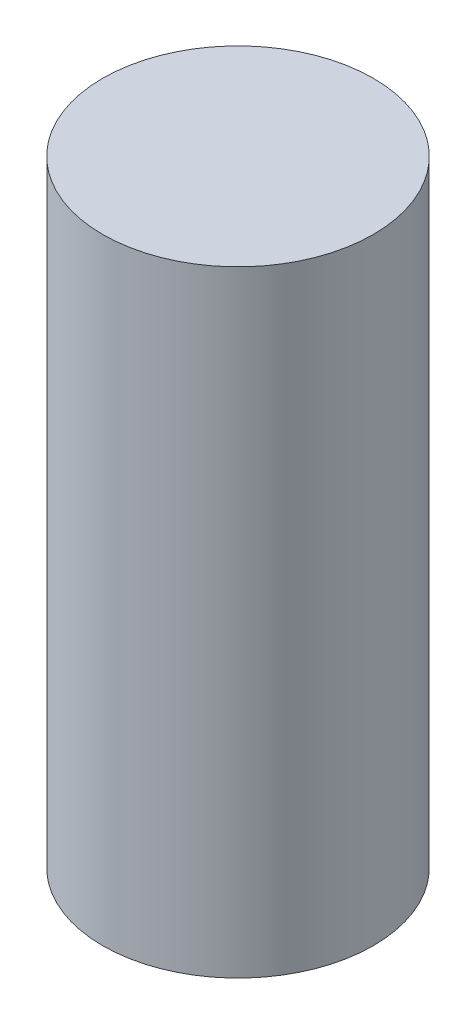
from build123d import *

# Parameters (mm, degrees)
SKETCH1_R           = 22.404077652
BOSS_EXTRUDE1_DEPTH = 102


with BuildPart() as part:
    # Sketch1 → Boss-Extrude1 (new body)
    with BuildSketch(Plane(origin=(0, 0, 0), x_dir=(1, 0, 0), z_dir=(0, 1, 0))):
        with Locations((2.600880996, 13.788975466)):
            Circle(SKETCH1_R)
    extrude(amount=BOSS_EXTRUDE1_DEPTH)


solid = part.part
